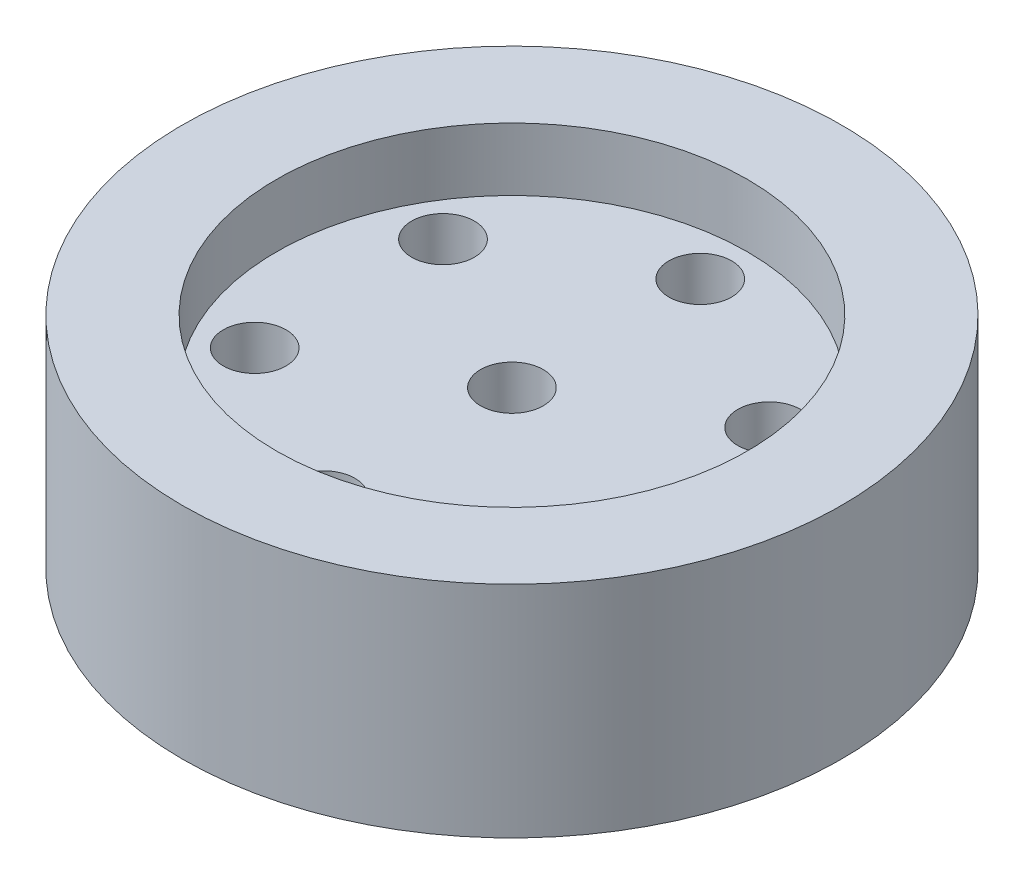
from build123d import *

# Parameters (mm, degrees)
SKETCH1_R           = 21
BOSS_EXTRUDE1_DEPTH = 14
SKETCH2_R           = 15
CUT_EXTRUDE1_DEPTH  = 4
SKETCH3_R           = 19
SKETCH3_R_2         = 5
CUT_EXTRUDE2_DEPTH  = 4
SKETCH4_R           = 2
CUT_EXTRUDE3_DEPTH  = 33.832910319
SKETCH5_R           = 2
CUT_EXTRUDE4_DEPTH  = 32.336879232


with BuildPart() as part:
    # Sketch1 → Boss-Extrude1 (new body)
    with BuildSketch(Plane(origin=(0, 0, 0), x_dir=(1, 0, 0), z_dir=(0, 1, 0))):
        Circle(SKETCH1_R)
    extrude(amount=BOSS_EXTRUDE1_DEPTH)

    # Sketch2 → Cut-Extrude1 (cut)
    with BuildSketch(Plane(origin=(0, 14, 0), x_dir=(1, 0, 0), z_dir=(0, 1, 0))):
        Circle(SKETCH2_R)
    extrude(amount=-CUT_EXTRUDE1_DEPTH, mode=Mode.SUBTRACT)

    # Sketch3 → Cut-Extrude2 (cut)
    with BuildSketch(Plane.XZ):
        Circle(SKETCH3_R)
        Circle(SKETCH3_R_2, mode=Mode.SUBTRACT)
    extrude(amount=-CUT_EXTRUDE2_DEPTH, mode=Mode.SUBTRACT)

    # Sketch4 → Cut-Extrude3 (cut, through all)
    with BuildSketch(Plane.XZ):
        Circle(SKETCH4_R)
    extrude(amount=-CUT_EXTRUDE3_DEPTH, mode=Mode.SUBTRACT)

    # Sketch5 → Cut-Extrude4 (cut, through all)
    with BuildSketch(Plane.XZ.offset(-4)):
        with Locations((0, 12)):
            Circle(SKETCH5_R)
        with Locations((10.392304845, 6)):
            Circle(SKETCH5_R)
        with Locations((10.392304845, -6)):
            Circle(SKETCH5_R)
        with Locations((0, -12)):
            Circle(SKETCH5_R)
        with Locations((-10.392304845, -6)):
            Circle(SKETCH5_R)
        with Locations((-10.392304845, 6)):
            Circle(SKETCH5_R)
    extrude(amount=-CUT_EXTRUDE4_DEPTH, mode=Mode.SUBTRACT)


solid = part.part
